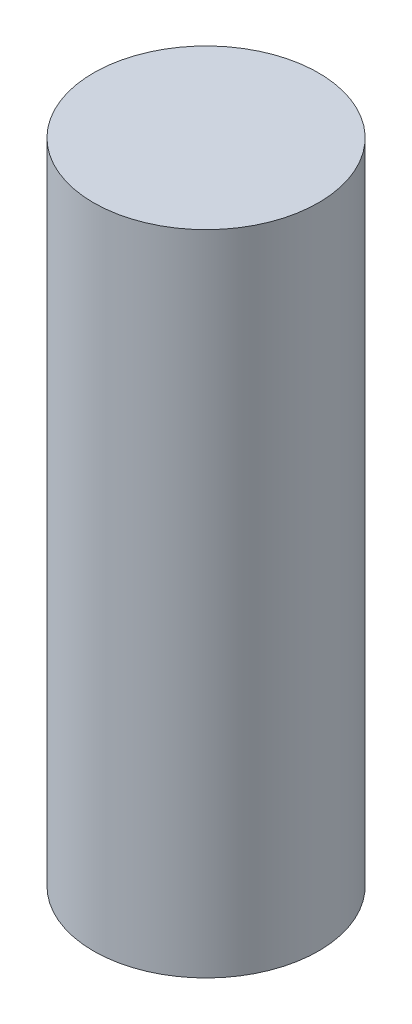
from build123d import *

# Parameters (mm, degrees)
SKETCH2_R           = 3.175
BOSS_EXTRUDE1_DEPTH = 18.288


with BuildPart() as part:
    # Sketch2 → Boss-Extrude1 (new body)
    with BuildSketch(Plane(origin=(0, 0, 0), x_dir=(-1, 0, 0), z_dir=(0, 1, 0))):
        Circle(SKETCH2_R)
    extrude(amount=BOSS_EXTRUDE1_DEPTH)


solid = part.part
